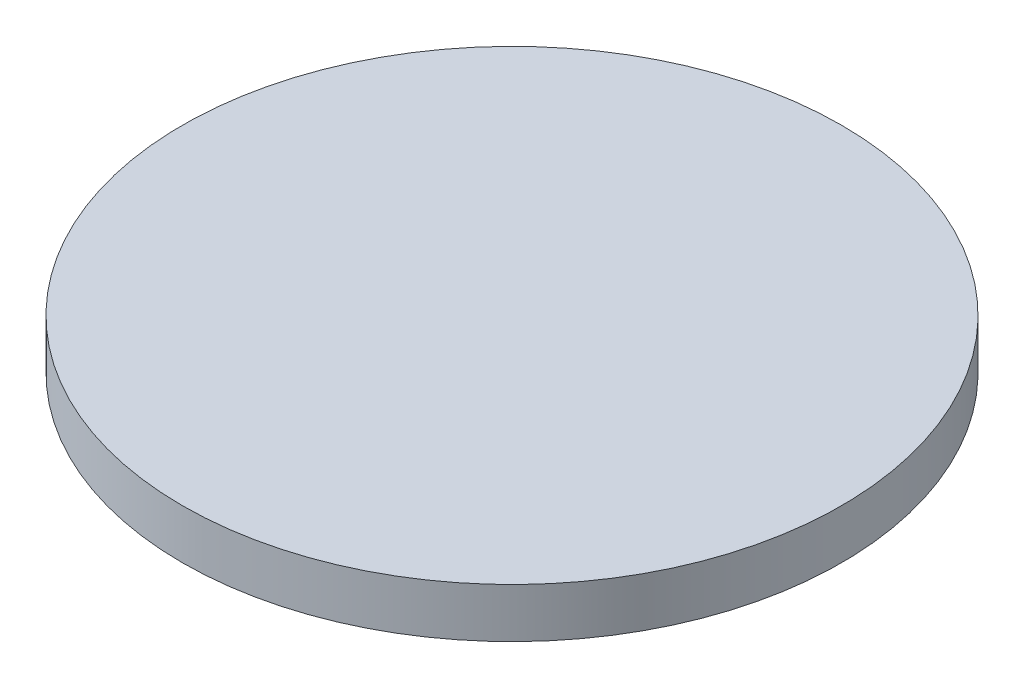
from build123d import *

# Parameters (mm, degrees)
SKETCH1_R           = 29.38
BOSS_EXTRUDE1_DEPTH = 4.41


with BuildPart() as part:
    # Sketch1 → Boss-Extrude1 (new body)
    with BuildSketch(Plane(origin=(0, 0, 0), x_dir=(1, 0, 0), z_dir=(0, 1, 0))):
        Circle(SKETCH1_R)
    extrude(amount=BOSS_EXTRUDE1_DEPTH)


solid = part.part
